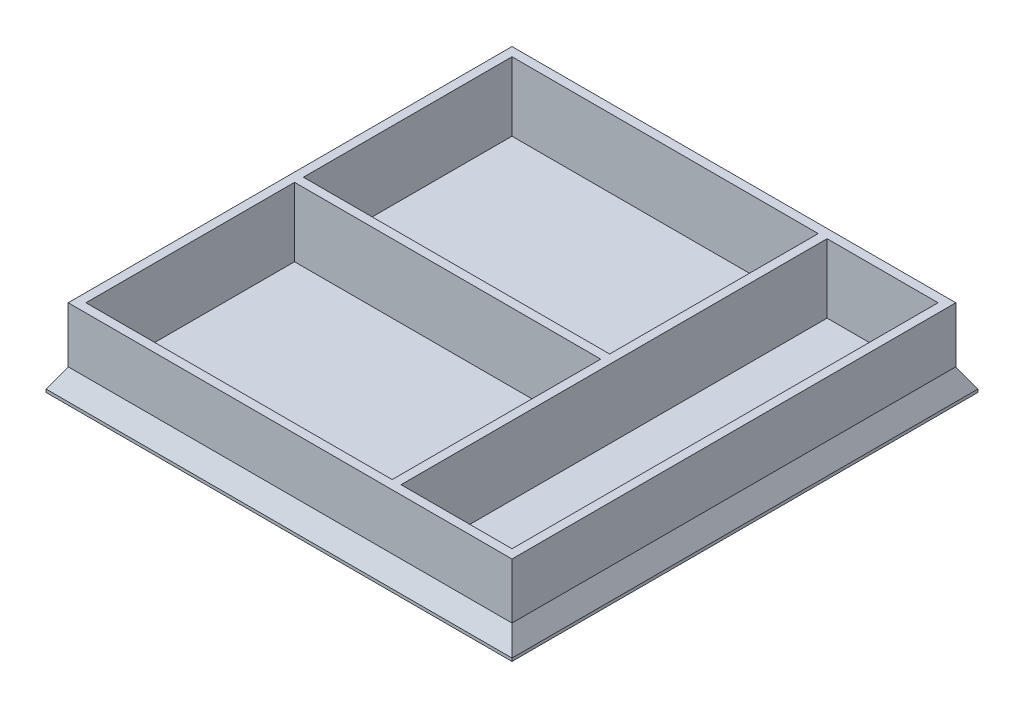
from build123d import *
from OCP.BRepFilletAPI import BRepFilletAPI_MakeChamfer

# Parameters (mm, degrees)
SKICA1_W                = 84
SKICA1_H                = 84
P_IDAT_VYSUNUT_M1_DEPTH = 1.6
SKICA1_3_W              = 80
SKICA1_3_H              = 80
SKICA1_3_W_2            = 20
SKICA1_3_H_2            = 76.8
SKICA1_3_W_3            = 55.2
SKICA1_3_H_3            = 37.6
P_IDAT_VYSUNUT_M2_DEPTH = 14
SKICA1_4_W              = 84
SKICA1_4_H              = 84
SKICA1_4_W_2            = 80
SKICA1_4_H_2            = 80
P_IDAT_VYSUNUT_M3_DEPTH = 4
ZKOSEN_2_SIZE           = 3.464101615
ZKOSEN_2_SIZE_2         = 2


with BuildPart() as part:
    # Skica1 → Přidat vysunutím1 (new body)
    with BuildSketch(Plane(origin=(0, 0, 0), x_dir=(1, 0, 0), z_dir=(0, 1, 0))):
        with Locations((-42, 42)):
            Rectangle(SKICA1_W, SKICA1_H)
    extrude(amount=P_IDAT_VYSUNUT_M1_DEPTH)

    # Skica1<3> → Přidat vysunutím2 (add)
    with BuildSketch(Plane(origin=(0, 0, 0), x_dir=(1, 0, 0), z_dir=(0, 1, 0))):
        with Locations((-42, 42)):
            Rectangle(SKICA1_3_W, SKICA1_3_H)
        with Locations((-13.6, 42)):
            Rectangle(SKICA1_3_W_2, SKICA1_3_H_2, mode=Mode.SUBTRACT)
        with Locations((-52.8, 61.6)):
            Rectangle(SKICA1_3_W_3, SKICA1_3_H_3, mode=Mode.SUBTRACT)
        with Locations((-52.8, 22.4)):
            Rectangle(SKICA1_3_W_3, SKICA1_3_H_3, mode=Mode.SUBTRACT)
    extrude(amount=P_IDAT_VYSUNUT_M2_DEPTH)

    # Skica1<4> → Přidat vysunutím3 (add)
    with BuildSketch(Plane(origin=(0, 0, 0), x_dir=(1, 0, 0), z_dir=(0, 1, 0))):
        with Locations((-42, 42)):
            Rectangle(SKICA1_4_W, SKICA1_4_H)
        with Locations((-42, 42)):
            Rectangle(SKICA1_4_W_2, SKICA1_4_H_2, mode=Mode.SUBTRACT)
    extrude(amount=P_IDAT_VYSUNUT_M3_DEPTH)

    # Zkosení2
    zkosen_2_edges_1 = [part.edges().sort_by_distance(p)[0] for p in [
        (-84, 4, -42),
    ]]
    zkosen_2_side_1 = [part.faces().sort_by_distance(p)[0] for p in [
        (-84, 3.96, -42),
    ]]
    zkosen_2_edges_2 = [part.edges().sort_by_distance(p)[0] for p in [
        (-42, 4, 0),
    ]]
    zkosen_2_side_2 = [part.faces().sort_by_distance(p)[0] for p in [
        (-42, 3.96, 0),
    ]]
    zkosen_2_edges_3 = [part.edges().sort_by_distance(p)[0] for p in [
        (0, 4, -42),
    ]]
    zkosen_2_side_3 = [part.faces().sort_by_distance(p)[0] for p in [
        (-0.04, 4, -42),
    ]]
    zkosen_2_edges_4 = [part.edges().sort_by_distance(p)[0] for p in [
        (-42, 4, -84),
    ]]
    zkosen_2_side_4 = [part.faces().sort_by_distance(p)[0] for p in [
        (-42, 3.96, -84),
    ]]
    zkosen_2 = BRepFilletAPI_MakeChamfer(part.part.solid().wrapped)
    for e in zkosen_2_edges_1:
        zkosen_2.Add(ZKOSEN_2_SIZE - 0.0001, ZKOSEN_2_SIZE_2 - 0.0001, e.wrapped, zkosen_2_side_1[0].wrapped)
    for e in zkosen_2_edges_2:
        zkosen_2.Add(ZKOSEN_2_SIZE - 0.0001, ZKOSEN_2_SIZE_2 - 0.0001, e.wrapped, zkosen_2_side_2[0].wrapped)
    for e in zkosen_2_edges_3:
        zkosen_2.Add(ZKOSEN_2_SIZE_2 - 0.0001, ZKOSEN_2_SIZE - 0.0001, e.wrapped, zkosen_2_side_3[0].wrapped)
    for e in zkosen_2_edges_4:
        zkosen_2.Add(ZKOSEN_2_SIZE - 0.0001, ZKOSEN_2_SIZE_2 - 0.0001, e.wrapped, zkosen_2_side_4[0].wrapped)
    add(Compound.cast(zkosen_2.Shape()), mode=Mode.REPLACE)  # a hair under: the kernel refuses the full size


solid = part.part
